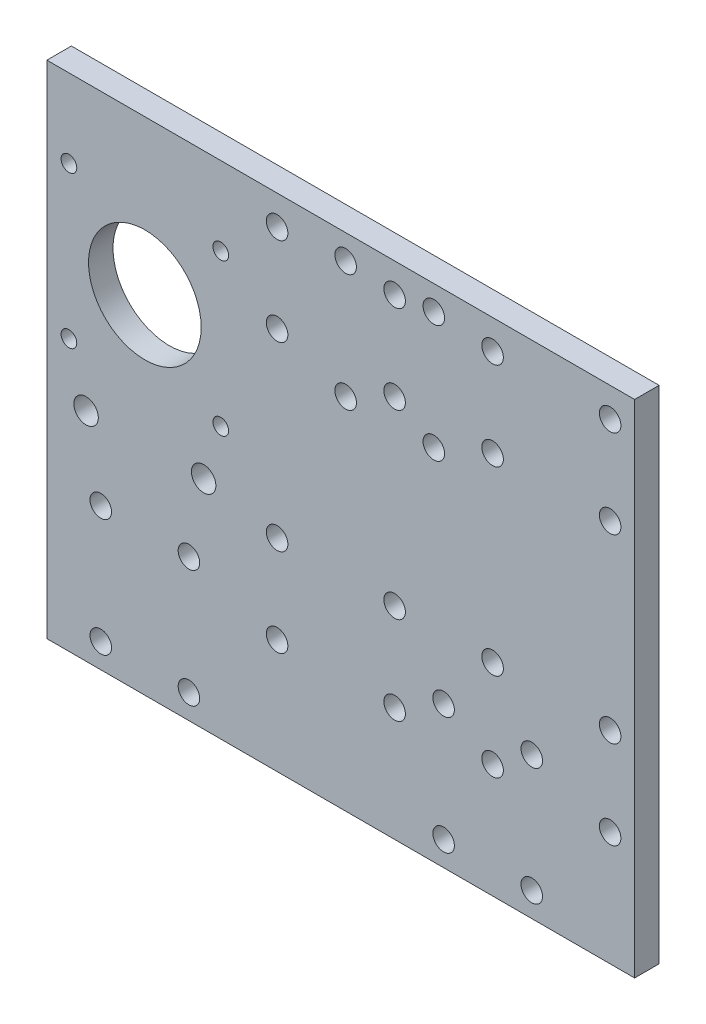
from build123d import *

# Parameters (mm, degrees)
SKETCH1_W           = 120
SKETCH1_H           = 102.3
BOSS_EXTRUDE1_DEPTH = 5
SKETCH4_R           = 2.2
CUT_EXTRUDE1_DEPTH  = 5
LPATTERN1_COUNT     = 2
LPATTERN1_PITCH     = 70
SKETCH6_R           = 1.6
SKETCH6_R_2         = 11.5
CUT_EXTRUDE4_DEPTH  = 10
SKETCH8_R           = 2.2
CUT_EXTRUDE5_DEPTH  = 10
SKETCH9_R           = 2.5
CUT_EXTRUDE6_DEPTH  = 10


with BuildPart() as part:
    # Sketch1 → Boss-Extrude1 (new body)
    with BuildSketch(Plane.XY):
        Rectangle(SKETCH1_W, SKETCH1_H)
    extrude(amount=BOSS_EXTRUDE1_DEPTH)

    # Sketch4 → Cut-Extrude1 (cut)
    with BuildSketch(Plane.XY.offset(5)):
        with Locations((39, -22.15)):
            Circle(SKETCH4_R)
        with Locations((39, -46.15)):
            Circle(SKETCH4_R)
        with Locations((21, -46.15)):
            Circle(SKETCH4_R)
        with Locations((21, -22.15)):
            Circle(SKETCH4_R)
    cut_extrude1 = extrude(amount=-CUT_EXTRUDE1_DEPTH, mode=Mode.SUBTRACT)

    # LPattern1: Cut-Extrude1 ×2
    with Locations(*[(-i * LPATTERN1_PITCH, 0, 0) for i in range(1, LPATTERN1_COUNT)]):
        add(cut_extrude1, mode=Mode.SUBTRACT)

    # Sketch6 → Cut-Extrude4 (cut)
    with BuildSketch(Plane.XY.offset(5)):
        with Locations((-55.499999987, 35.149359505)):
            Circle(SKETCH6_R)
        with Locations((-24.500000013, 35.150640495)):
            Circle(SKETCH6_R)
        with Locations((-55.499999987, 4.149359505)):
            Circle(SKETCH6_R)
        with Locations((-24.500000013, 4.150640495)):
            Circle(SKETCH6_R)
        with Locations((-40, 19.65)):
            Circle(SKETCH6_R_2)
    extrude(amount=-CUT_EXTRUDE4_DEPTH, mode=Mode.SUBTRACT)

    # Sketch8 → Cut-Extrude5 (cut)
    with BuildSketch(Plane.XY.offset(5)):
        with Locations((1, 46.15)):
            Circle(SKETCH8_R)
        with Locations((19, 46.15)):
            Circle(SKETCH8_R)
        with Locations((1, 22.15)):
            Circle(SKETCH8_R)
        with Locations((19, 22.15)):
            Circle(SKETCH8_R)
        with Locations((-13, 27.15)):
            Circle(SKETCH8_R)
        with Locations((-13, 45.15)):
            Circle(SKETCH8_R)
        with Locations((11, 27.15)):
            Circle(SKETCH8_R)
        with Locations((11, 45.15)):
            Circle(SKETCH8_R)
        with Locations((31, 27.15)):
            Circle(SKETCH8_R)
        with Locations((31, 45.15)):
            Circle(SKETCH8_R)
        with Locations((55, 27.15)):
            Circle(SKETCH8_R)
        with Locations((55, 45.15)):
            Circle(SKETCH8_R)
        with Locations((31, -27.85)):
            Circle(SKETCH8_R)
        with Locations((31, -9.85)):
            Circle(SKETCH8_R)
        with Locations((55, -27.85)):
            Circle(SKETCH8_R)
        with Locations((55, -9.85)):
            Circle(SKETCH8_R)
        with Locations((-13, -27.85)):
            Circle(SKETCH8_R)
        with Locations((-13, -9.85)):
            Circle(SKETCH8_R)
        with Locations((11, -27.85)):
            Circle(SKETCH8_R)
        with Locations((11, -9.85)):
            Circle(SKETCH8_R)
    extrude(amount=-CUT_EXTRUDE5_DEPTH, mode=Mode.SUBTRACT)

    # Sketch9 → Cut-Extrude6 (cut)
    with BuildSketch(Plane.XY.offset(5)):
        with Locations((-52, -6.85)):
            Circle(SKETCH9_R)
        with Locations((-28, -6.85)):
            Circle(SKETCH9_R)
    extrude(amount=-CUT_EXTRUDE6_DEPTH, mode=Mode.SUBTRACT)


solid = part.part
